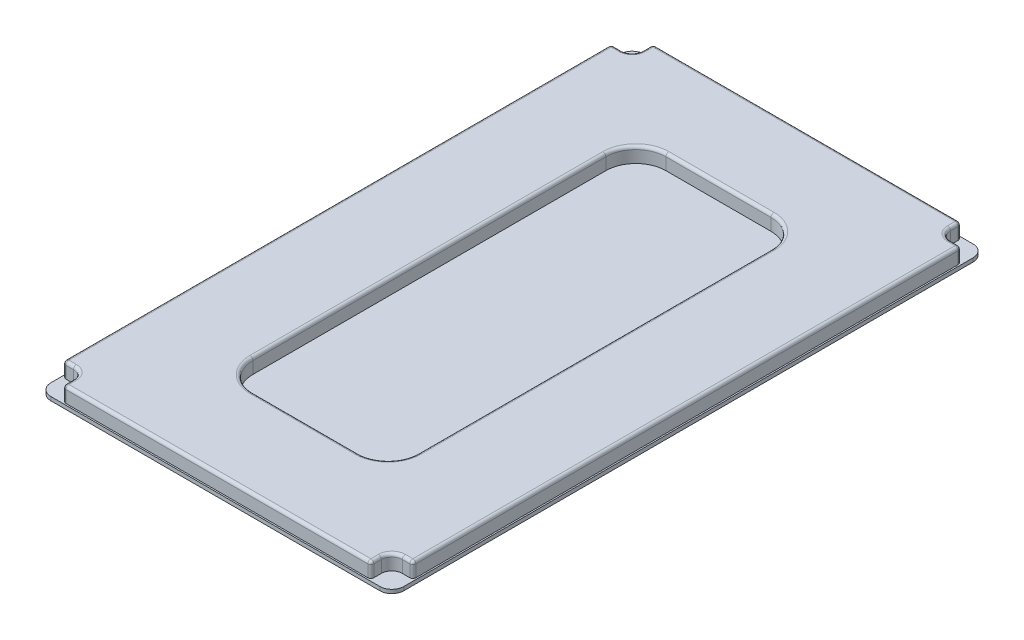
from build123d import *

# Parameters (mm, degrees)
BASE_FLANGE1_DEPTH = 0.79375
EXTRUDE1_DEPTH     = 3.175
FILLET1_R          = 0.635
FILLET2_R          = 0.635


# Sheet-metal steps are written as plain solids
with BuildPart() as part:
    # Sketch1 → Base-Flange1 (new body)
    with BuildSketch(Plane(origin=(0, 0, 0), x_dir=(1, 0, 0), z_dir=(0, 1, 0))):
        with BuildLine():
            Line((2.54, 0), (72.0725, 0))
            ThreePointArc((72.0725, 0), (73.868551224, 0.743948776), (74.6125, 2.54))
            Line((74.6125, 2.54), (74.6125, 122.8725))
            ThreePointArc((74.6125, 122.8725), (73.868551224, 124.668551224), (72.0725, 125.4125))
            Line((72.0725, 125.4125), (2.54, 125.4125))
            ThreePointArc((2.54, 125.4125), (0.743948776, 124.668551224), (0, 122.8725))
            Line((0, 122.8725), (0, 2.54))
            ThreePointArc((0, 2.54), (0.743948776, 0.743948776), (2.54, 0))
        make_face()
    extrude(amount=BASE_FLANGE1_DEPTH)


with BuildPart() as body_2:
    # Sketch3 → Extrude1 (new body)
    with BuildSketch(Plane(origin=(0, 0.79375, 0), x_dir=(-1, 0, 0), z_dir=(0, 1, 0))):
        with BuildLine():
            Line((-69.85, -125.095), (-4.7625, -125.095))
            Line((-4.7625, -125.095), (-4.7625, -122.8725))
            ThreePointArc((-4.7625, -122.8725), (-4.111544821, -121.300955179), (-2.54, -120.65))
            Line((-2.54, -120.65), (-0.3175, -120.65))
            Line((-0.3175, -120.65), (-0.3175, -4.7625))
            Line((-0.3175, -4.7625), (-2.54, -4.7625))
            ThreePointArc((-2.54, -4.7625), (-4.111544821, -4.111544821), (-4.7625, -2.54))
            Line((-4.7625, -2.54), (-4.7625, -0.3175))
            Line((-4.7625, -0.3175), (-69.85, -0.3175))
            Line((-69.85, -0.3175), (-69.85, -2.54))
            ThreePointArc((-69.85, -2.54), (-70.500955179, -4.111544821), (-72.0725, -4.7625))
            Line((-72.0725, -4.7625), (-74.295, -4.7625))
            Line((-74.295, -4.7625), (-74.295, -120.65))
            Line((-74.295, -120.65), (-72.0725, -120.65))
            ThreePointArc((-72.0725, -120.65), (-70.500955179, -121.300955179), (-69.85, -122.8725))
            Line((-69.85, -122.8725), (-69.85, -125.095))
        make_face()
        with BuildLine():
            Line((-26.19375, -19.05), (-48.41875, -19.05))
            ThreePointArc((-48.41875, -19.05), (-52.908878061, -20.909871939), (-54.76875, -25.4))
            Line((-54.76875, -25.4), (-54.76875, -100.0125))
            ThreePointArc((-54.76875, -100.0125), (-52.908878061, -104.502628061), (-48.41875, -106.3625))
            Line((-48.41875, -106.3625), (-26.19375, -106.3625))
            ThreePointArc((-26.19375, -106.3625), (-21.703621939, -104.502628061), (-19.84375, -100.0125))
            Line((-19.84375, -100.0125), (-19.84375, -25.4))
            ThreePointArc((-19.84375, -25.4), (-21.703621939, -20.909871939), (-26.19375, -19.05))
        make_face(mode=Mode.SUBTRACT)
    extrude(amount=EXTRUDE1_DEPTH)

    # Fillet1
    fillet1_edges = [body_2.edges().sort_by_distance(p)[0] for p in [
        (0.3175, 2.38125, -4.7625),
        (0.3175, 2.38125, -120.65),
        (4.7625, 2.38125, -125.095),
        (69.85, 2.38125, -125.095),
        (74.295, 2.38125, -120.65),
        (74.295, 2.38125, -4.7625),
        (69.85, 2.38125, -0.3175),
        (4.7625, 2.38125, -0.3175),
    ]]
    fillet(fillet1_edges, radius=FILLET1_R)

    # Fillet2
    fillet2_edges = [body_2.edges().sort_by_distance(p)[0] for p in [
        (70.500955179, 3.96875, -4.111544821),
        (72.86625, 3.96875, -4.7625),
        (70.500955179, 3.96875, -121.300955179),
        (69.85, 3.96875, -123.66625),
        (4.111544821, 3.96875, -4.111544821),
        (4.111544821, 3.96875, -121.300955179),
        (1.74625, 3.96875, -120.65),
        (21.703621939, 3.96875, -104.502628061),
        (19.84375, 3.96875, -62.70625),
        (21.703621939, 3.96875, -20.909871939),
        (37.30625, 3.96875, -19.05),
        (52.908878061, 3.96875, -20.909871939),
        (54.76875, 3.96875, -62.70625),
        (52.908878061, 3.96875, -104.502628061),
        (37.30625, 3.96875, -106.3625),
        (4.7625, 3.96875, -1.74625),
        (1.74625, 3.96875, -4.7625),
        (0.3175, 3.96875, -62.70625),
        (37.30625, 3.96875, -0.3175),
        (69.85, 3.96875, -1.74625),
        (74.295, 3.96875, -62.70625),
        (72.86625, 3.96875, -120.65),
        (37.30625, 3.96875, -125.095),
        (4.7625, 3.96875, -123.66625),
        (4.948487194, 3.96875, -124.909012806),
        (0.503487194, 3.96875, -120.464012806),
        (69.664012806, 3.96875, -124.909012806),
        (74.109012806, 3.96875, -120.464012806),
        (74.109012806, 3.96875, -4.948487194),
        (69.664012806, 3.96875, -0.503487194),
        (4.948487194, 3.96875, -0.503487194),
        (0.503487194, 3.96875, -4.948487194),
    ]]
    fillet(fillet2_edges, radius=FILLET2_R)


solid = Compound([part.part, body_2.part])
